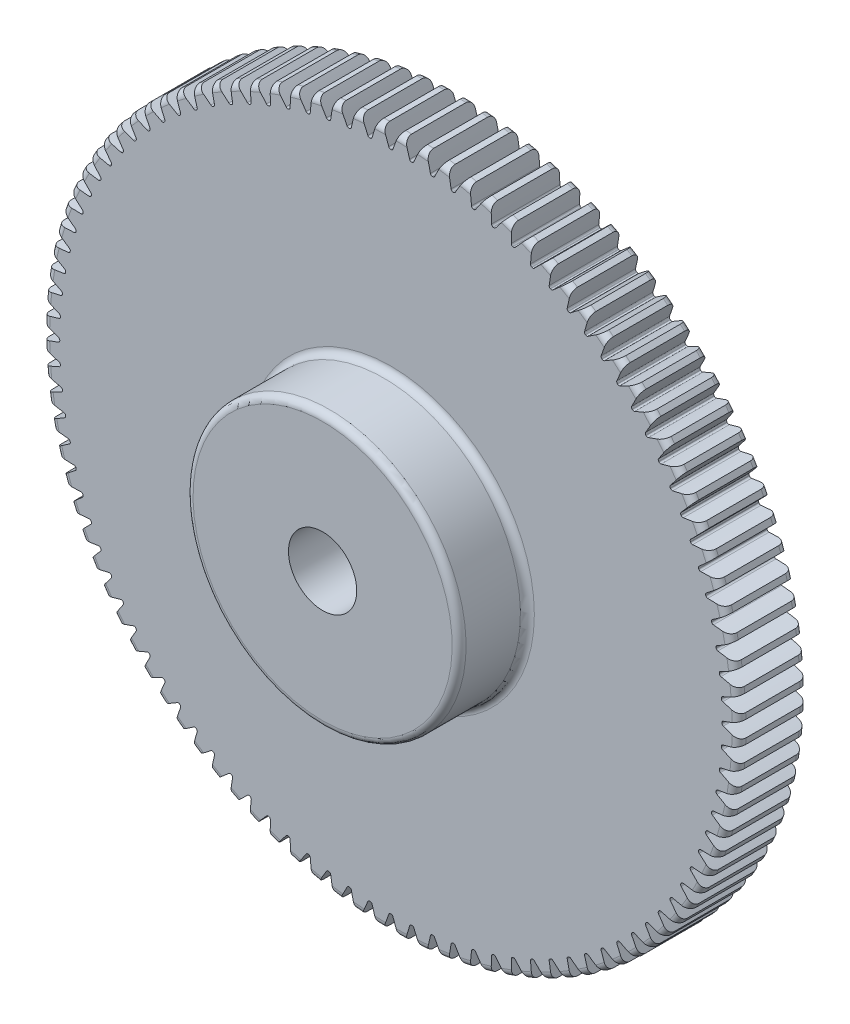
from build123d import *

# Parameters (mm, degrees)
FILLET2_R          = 1.02
CUT_EXTRUDE2_DEPTH = 73.814833724
CIRPATTERN1_COUNT  = 100


with BuildPart() as part:
    # Sketch4 → Revolve1 (revolve)
    with BuildSketch(Plane(origin=(0, 0, 0), x_dir=(0, 0, -1), z_dir=(1, 0, 0))):
        Polygon((-20, 5), (-20, 20), (-10, 20), (-10, 51), (0, 51), (0, 5), align=None)
    revolve(axis=Axis((0, 0, 10), (0, 0, 1)))

    # Fillet2
    fillet2_edges = [part.edges().sort_by_distance(p)[0] for p in [
        (0, -20, 20),
        (0, -20, 10),
        (0, -51, 10),
        (0, -51, 0),
    ]]
    fillet(fillet2_edges, radius=FILLET2_R)

    # Sketch7 → Cut-Extrude2 (cut, through all)
    with BuildSketch(Plane.XY.offset(10)):
        with BuildLine():
            ThreePointArc((-0.028581303, 48.499991578), (0, 48.5), (0.028581303, 48.499991578))
            ThreePointArc((0.028581303, 48.499991578), (0.202222598, 48.555221259), (0.311880971, 48.700743277))
            ThreePointArc((0.311880971, 48.700743277), (0.73026655, 49.84886835), (1.176584825, 50.986426117))
            ThreePointArc((1.176584825, 50.986426117), (0, 51), (-1.176584825, 50.986426117))
            ThreePointArc((-1.176584825, 50.986426117), (-0.73026655, 49.84886835), (-0.311880971, 48.700743277))
            ThreePointArc((-0.311880971, 48.700743277), (-0.202222598, 48.555221259), (-0.028581303, 48.499991578))
        make_face()
    cut_extrude2 = extrude(amount=-CUT_EXTRUDE2_DEPTH, mode=Mode.SUBTRACT)

    # CirPattern1: Cut-Extrude2 ×100 about axis
    cirpattern1_axis = Axis((0, 0, 20), (0, 0, -1))
    for i in range(1, CIRPATTERN1_COUNT):
        add(cut_extrude2.rotate(cirpattern1_axis, i * 360 / CIRPATTERN1_COUNT), mode=Mode.SUBTRACT)


solid = part.part
